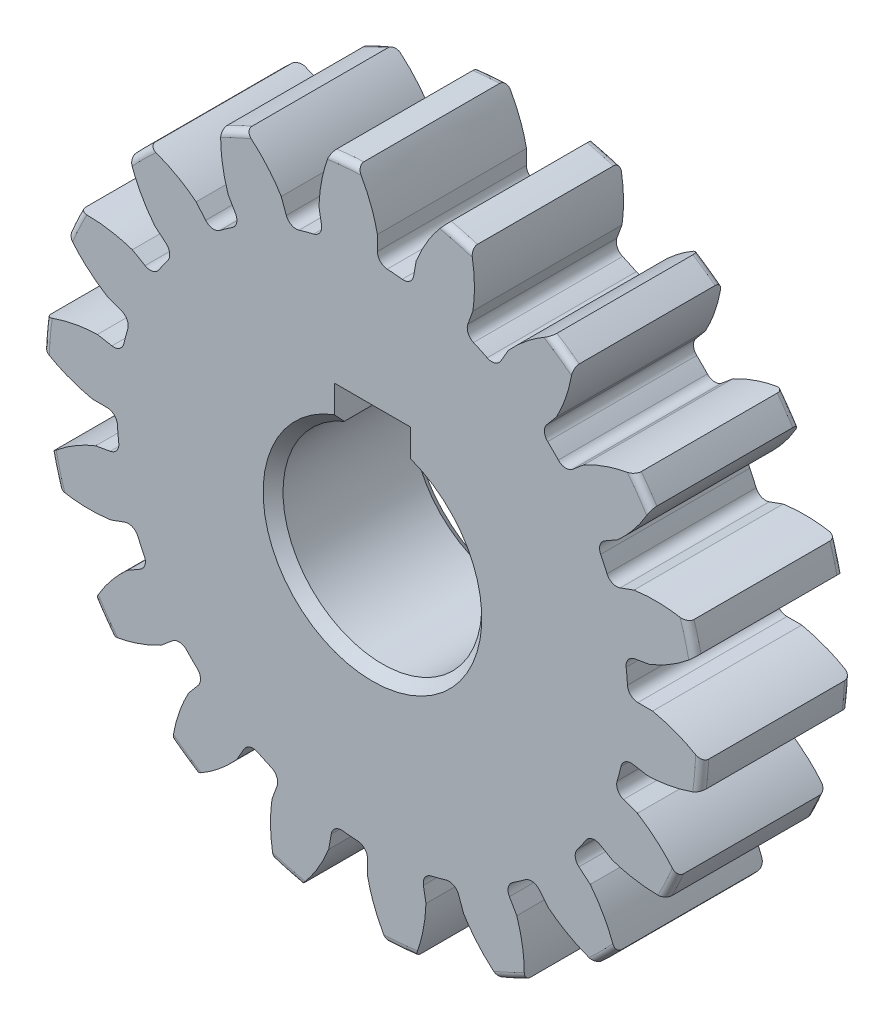
from build123d import *

# Parameters (mm, degrees)
SKETCH1_R                = 10.541
BOSS_EXTRUDE1_DEPTH      = 4.7625
SKETCH2_W                = 6.3373
SKETCH2_H                = 6.35
FILLET2_R                = 0.21082
CUT_EXTRUDE1_DEPTH       = 19.585772146
FILLET1_R                = 0.332486
CIRPATTERN1_COUNT        = 18
FILLET1_OF_CIRPATTERN1_R = 0.332486
SKETCH5_R                = 3.175
CUT_EXTRUDE2_DEPTH       = 19.572998108
SKETCH6_R                = 9.525
CUT_EXTRUDE3_DEPTH       = 17.183697661
CHAMFER1_SIZE            = 0.3175
CUT_EXTRUDE4_DEPTH       = 16.634324606
CUT_EXTRUDE4_DEPTH_BACK  = 16.634324606
SKETCH7_W                = 2.43205
SKETCH7_H                = 2.43205


with BuildPart() as part:
    # Sketch1 → Boss-Extrude1 (new body)
    with BuildSketch(Plane.XY):
        Circle(SKETCH1_R)
    extrude(amount=-BOSS_EXTRUDE1_DEPTH)

    # Sketch2 → Revolve1 (revolve)
    with BuildSketch(Plane(origin=(0, 0, 0), x_dir=(0, 0, -1), z_dir=(1, 0, 0))):
        with Locations((7.93115, 3.175)):
            Rectangle(SKETCH2_W, SKETCH2_H)
    revolve(axis=Axis((0, 0, -4.7625), (0, 0, -1)))

    # Fillet2
    fillet2_edges = [part.edges().sort_by_distance(p)[0] for p in [
        (-10.541, 0, -4.7625),
        (-10.541, 0, 0),
        (0, -6.35, -4.7625),
    ]]
    fillet(fillet2_edges, radius=FILLET2_R)

    # Sketch4 → Cut-Extrude1 (cut, through all)
    with BuildSketch(Plane.XY):
        with BuildLine():
            Line((0.157561629, 8.949185285), (0.157561629, 8.158228631))
            ThreePointArc((0.157561629, 8.158228631), (0.711170731, 8.128699543), (1.261496911, 8.061646582))
            Line((1.261496911, 8.061646582), (1.398845411, 8.840586771))
            add(Edge.make_bspline(
                [(4.497758077, 11.696351513), (2.192075376, 10.823747212), (1.398845411, 8.840586771)],
                knots=[0, 0, 0, 1, 1, 1], degree=2))
            ThreePointArc((4.497758077, 11.696351513), (1.092180738, 12.483653619), (-2.39837188, 12.299686125))
            add(Edge.make_bspline(
                [(-2.39837188, 12.299686125), (-0.279244341, 11.039960179), (0.157561629, 8.949185285)],
                knots=[0, 0, 0, 1, 1, 1], degree=2))
        make_face()
    cut_extrude1 = extrude(amount=-CUT_EXTRUDE1_DEPTH, mode=Mode.SUBTRACT)

    # Fillet1
    fillet1_edges = [part.edges().sort_by_distance(p)[0] for p in [
        (1.261496911, 8.061646582, -2.38125),
        (0.157561629, 8.158228631, -2.38125),
    ]]
    fillet(fillet1_edges, radius=FILLET1_R)

    # CirPattern1: Cut-Extrude1 ×18 about axis
    cirpattern1_axis = Axis((0, 0, -4.7625), (0, 0, 1))
    for i in range(1, CIRPATTERN1_COUNT):
        add(cut_extrude1.rotate(cirpattern1_axis, i * 360 / CIRPATTERN1_COUNT), mode=Mode.SUBTRACT)

    # Fillet1 of CirPattern1
    fillet1_of_cirpattern1_edges = [part.edges().sort_by_distance(p)[0] for p in [
        (-1.57182618, 8.006927158, -2.38125),
        (-2.642219026, 7.720116494, -2.38125),
        (-4.215563837, 6.98645415, -2.38125),
        (-5.123309071, 6.350844371, -2.38125),
        (-6.35084228, 5.123311663, -2.38125),
        (-6.98645243, 4.215566689, -2.38125),
        (-7.720115416, 2.642222177, -2.38125),
        (-8.006926517, 1.571829448, -2.38125),
        (-8.158228695, -0.157558299, -2.38125),
        (-8.061647096, -1.261493621, -2.38125),
        (-7.612339192, -2.938334919, -2.38125),
        (-7.144014059, -3.942661942, -2.38125),
        (-6.148289235, -5.364704982, -2.38125),
        (-5.364707491, -6.148287046, -2.38125),
        (-3.942664858, -7.14401245, -2.38125),
        (-2.938338026, -7.612337992, -2.38125),
        (-1.261496911, -8.061646582, -2.38125),
        (-0.157561629, -8.158228631, -2.38125),
        (1.57182618, -8.006927158, -2.38125),
        (2.642219026, -7.720116494, -2.38125),
        (4.215563837, -6.98645415, -2.38125),
        (5.123309071, -6.350844371, -2.38125),
        (6.35084228, -5.123311663, -2.38125),
        (6.98645243, -4.215566689, -2.38125),
        (7.720115416, -2.642222177, -2.38125),
        (8.006926517, -1.571829448, -2.38125),
        (8.158228695, 0.157558299, -2.38125),
        (8.061647096, 1.261493621, -2.38125),
        (7.612339192, 2.938334919, -2.38125),
        (7.144014059, 3.942661942, -2.38125),
        (6.148289235, 5.364704982, -2.38125),
        (5.364707491, 6.148287046, -2.38125),
        (3.942664858, 7.14401245, -2.38125),
        (2.938338026, 7.612337992, -2.38125),
    ]]
    fillet(fillet1_of_cirpattern1_edges, radius=FILLET1_OF_CIRPATTERN1_R)

    # Sketch5 → Cut-Extrude2 (cut, through all)
    with BuildSketch(Plane.XY):
        Circle(SKETCH5_R)
    extrude(amount=-CUT_EXTRUDE2_DEPTH, mode=Mode.SUBTRACT)

    # Sketch6 → Cut-Extrude3 (cut, through all)
    with BuildSketch(Plane(origin=(0, 0, -4.7625), x_dir=(-1, 0, 0), z_dir=(0, 0, -1))):
        Circle(SKETCH6_R)
    extrude(amount=CUT_EXTRUDE3_DEPTH, mode=Mode.SUBTRACT)

    # Chamfer1
    chamfer1_edges = [part.edges().sort_by_distance(p)[0] for p in [
        (-3.175, 0, 0),
        (-3.175, 0, -4.7625),
    ]]
    chamfer(chamfer1_edges, length=CHAMFER1_SIZE)

    # Sketch7 → Cut-Extrude4 (cut, two sides: drawn at the far end of the back side and taken through both)
    with BuildSketch(Plane(origin=(0, 0, -4.7625), x_dir=(-1, 0, 0), z_dir=(0, 0, -1)).offset(-CUT_EXTRUDE4_DEPTH_BACK)):
        with Locations((0, 2.932900987)):
            Rectangle(SKETCH7_W, SKETCH7_H)
    extrude(amount=CUT_EXTRUDE4_DEPTH + CUT_EXTRUDE4_DEPTH_BACK, mode=Mode.SUBTRACT)


solid = part.part
